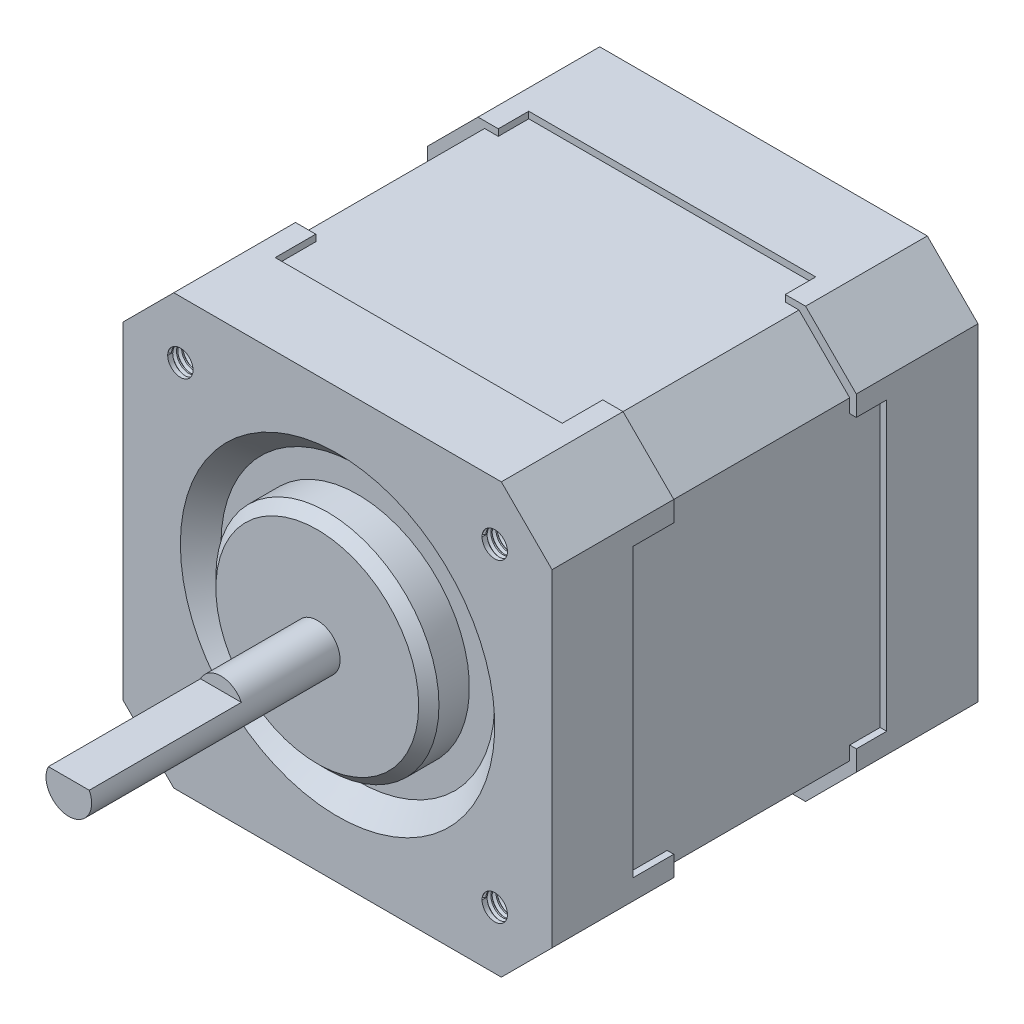
from build123d import *

# Parameters (mm, degrees)
BOSS_EXTRUDE1_DEPTH        = 12
CUT_EXTRUDE1_DEPTH         = 6
CUT_EXTRUDE2_REACH         = 50.792
SKETCH3_W                  = 4
SKETCH3_H                  = 28.3
CUT_EXTRUDE3_DEPTH         = 49.79152078
CUT_EXTRUDE3_DEPTH_BACK    = 49.79152078
SKETCH4_W                  = 28.3
SKETCH4_H                  = 4
BOSS_EXTRUDE2_DEPTH        = 36
BOSS_EXTRUDE5_DEPTH        = 6
CUT_EXTRUDE6_DEPTH         = 6
SKETCH12_W                 = 3
SKETCH12_H                 = 28.3
CUT_EXTRUDE7_DEPTH         = 64.250395256
SKETCH14_R                 = 11
BOSS_EXTRUDE6_DEPTH        = 4
CHAMFER1_SIZE              = 1
SKETCH15_R                 = 2.25
BOSS_EXTRUDE7_DEPTH        = 24.5
CUT_EXTRUDE8_START         = -15
CUT_EXTRUDE8_DEPTH         = 15
SKETCH17_W                 = 28.3
SKETCH17_H                 = 3
CUT_EXTRUDE9_DEPTH         = 64.250395256
M3_TAPPED_HOLE1_AT_2_COUNT = 2
M3_TAPPED_HOLE1_AT_2_PITCH = 31
M3_TAPPED_HOLE1_AT_3_COUNT = 2
M3_TAPPED_HOLE1_AT_3_PITCH = 31
M3_TAPPED_HOLE1_AT_4_COUNT = 2
M3_TAPPED_HOLE1_AT_4_PITCH = 43.840620434
THREAD1_PITCH              = 0.5
THREAD2_PITCH              = 0.5
THREAD3_PITCH              = 0.5
THREAD4_PITCH              = 0.5


with BuildPart() as part:
    # Sketch1 → Boss-Extrude1 (new body)
    with BuildSketch(Plane.XY):
        Polygon((-16.15, 21.15), (16.15, 21.15), (21.15, 16.15), (21.15, -16.15), (16.15, -21.15), (-16.15, -21.15), (-21.15, -16.15), (-21.15, 16.15), align=None)
    extrude(amount=-BOSS_EXTRUDE1_DEPTH)

    # Sketch2 → Cut-Extrude1 (cut)
    with BuildSketch(Plane(origin=(0, 0, -12), x_dir=(-1, 0, 0), z_dir=(0, 0, -1))):
        Polygon((-20.5, 15.5), (-15.5, 20.5), (15.5, 20.5), (20.5, 15.5), (20.5, -15.5), (15.5, -20.5), (-15.5, -20.5), (-20.5, -15.5), align=None)
    extrude(amount=-CUT_EXTRUDE1_DEPTH, mode=Mode.SUBTRACT)

    # Cut-Extrude2: up to this face of the body (flat: up to its plane)
    cut_extrude2_end = Plane(part.part.faces().sort_by_distance((-21.15, 0, -6))[0])
    # Sketch3 → Cut-Extrude2 (cut, up to the picked face)
    with BuildSketch(Plane(origin=(21.15, 0, 0), x_dir=(0, 0, -1), z_dir=(1, 0, 0)), mode=Mode.PRIVATE) as cut_extrude2_sk1:
        with Locations((10, 0)):
            Rectangle(SKETCH3_W, SKETCH3_H)
    cut_extrude2_tool1 = split(extrude(cut_extrude2_sk1.sketch, amount=-CUT_EXTRUDE2_REACH, mode=Mode.PRIVATE), bisect_by=cut_extrude2_end, keep=Keep.BOTH, mode=Mode.PRIVATE)
    add(cut_extrude2_tool1.solids().sort_by(Axis((21.15, 0, -10), (-1, 0, 0)))[0], mode=Mode.SUBTRACT)

    # Sketch4 → Cut-Extrude3 (cut, two sides: drawn at the far end of the back side and taken through both)
    with BuildSketch(Plane(origin=(0, 21.15, 0), x_dir=(1, 0, 0), z_dir=(0, 1, 0)).offset(-CUT_EXTRUDE3_DEPTH_BACK)):
        with Locations((0, 10)):
            Rectangle(SKETCH4_W, SKETCH4_H)
    extrude(amount=CUT_EXTRUDE3_DEPTH + CUT_EXTRUDE3_DEPTH_BACK, mode=Mode.SUBTRACT)

    # Sketch5 → Boss-Extrude2 (add)
    with BuildSketch(Plane(origin=(0, 0, -6), x_dir=(-1, 0, 0), z_dir=(0, 0, -1))):
        Polygon((-15.5, -20.5), (-20.5, -15.5), (-20.5, 15.5), (-15.5, 20.5), (15.5, 20.5), (20.5, 15.5), (20.5, -15.5), (15.5, -20.5), align=None)
    extrude(amount=BOSS_EXTRUDE2_DEPTH)

    # Sketch13 → Cut-Revolve1 (revolve, cut)
    with BuildSketch(Plane(origin=(0, 0, 0), x_dir=(0, 0, -1), z_dir=(1, 0, 0)), mode=Mode.PRIVATE) as cut_revolve1_sk:
        Polygon((0, 0), (0, 15.5), (2, 13.5), (2, 0), align=None)
    revolve(cut_revolve1_sk.sketch.rotate(Axis((0, 0, -2), (0, 0, 1)), 90), axis=Axis((0, 0, -2), (0, 0, 1)), mode=Mode.SUBTRACT)

    # Sketch14 → Boss-Extrude6 (add)
    with BuildSketch(Plane.XY.offset(-2)):
        with Locations(Location((0, 0, 0), (0, 0, 180))):
            Circle(SKETCH14_R)
    extrude(amount=BOSS_EXTRUDE6_DEPTH)

    # Chamfer1
    chamfer1_edges = [part.edges().sort_by_distance(p)[0] for p in [
        (11, 0, 2),
    ]]
    chamfer(chamfer1_edges, length=CHAMFER1_SIZE)

    # Sketch15 → Boss-Extrude7 (add)
    with BuildSketch(Plane.XY.offset(2)):
        Circle(SKETCH15_R)
    extrude(amount=BOSS_EXTRUDE7_DEPTH)

    # Sketch16 → Cut-Extrude8 (cut)
    with BuildSketch(Plane.XY.offset(26.5).offset(CUT_EXTRUDE8_START)):
        with BuildLine():
            Line((-2.015564437, 1), (2.015564437, 1))
            ThreePointArc((2.015564437, 1), (0, 2.25), (-2.015564437, 1))
        make_face()
    extrude(amount=CUT_EXTRUDE8_DEPTH, mode=Mode.SUBTRACT)

    # Sketch20 → M3 Tapped Hole1 (revolve, cut)
    with BuildSketch(Plane(origin=(-15.5, 15.5, 0), x_dir=(0, -1, 0), z_dir=(1, 0, 0))):
        Polygon((0, 0), (0, 5.251075774), (1.25, 4.5), (1.25, 0), align=None)
    m3_tapped_hole1 = revolve(axis=Axis((-15.5, 15.5, 6.35), (0, 0, -1)), mode=Mode.SUBTRACT)

    # M3 Tapped Hole1 at 2: M3 Tapped Hole1 ×2
    with Locations(*[(i * M3_TAPPED_HOLE1_AT_2_PITCH, 0, 0) for i in range(1, M3_TAPPED_HOLE1_AT_2_COUNT)]):
        add(m3_tapped_hole1, mode=Mode.SUBTRACT)

    # M3 Tapped Hole1 at 3: M3 Tapped Hole1 ×2
    with Locations(*[(0, -i * M3_TAPPED_HOLE1_AT_3_PITCH, 0) for i in range(1, M3_TAPPED_HOLE1_AT_3_COUNT)]):
        add(m3_tapped_hole1, mode=Mode.SUBTRACT)

    # M3 Tapped Hole1 at 4: M3 Tapped Hole1 ×2
    with Locations(*[Vector(0.7071067811865476, -0.7071067811865476, 0) * (i * M3_TAPPED_HOLE1_AT_4_PITCH) for i in range(1, M3_TAPPED_HOLE1_AT_4_COUNT)]):
        add(m3_tapped_hole1, mode=Mode.SUBTRACT)

    # Thread1: the profile of Thread Profile1 profile screwed along a right-hand helix of 9 turns, 6 arcs to a turn; built about Z, then put on its axis
    thread1_z = Axis((0, 0, 0), (0, 0, 1))
    thread1_corners = [(1.2497, 0, -0.000173205), (1.520632937, 0, 0.156249999), (1.520632937, 0, 0.218749999), (1.2497, 0, 0.375173204)]
    with BuildLine(mode=Mode.PRIVATE) as thread1_profile:
        Line(thread1_corners[0], thread1_corners[1])
        Line(thread1_corners[1], thread1_corners[2])
        Line(thread1_corners[2], thread1_corners[3])
        Line(thread1_corners[3], thread1_corners[0])
    thread1_cap = Face(thread1_profile.wire())
    thread1_turn_angles = [0, 30, 60, 90, 120, 150, 180, 210, 240, 270, 300, 330, 360]
    thread1_turn_weights = [1, 0.8660254037844387, 1, 0.8660254037844387, 1, 0.8660254037844387, 1, 0.8660254037844387, 1, 0.8660254037844387, 1, 0.8660254037844387, 1]
    thread1_turn_rails = [Edge.make_bspline([Vector(p[0], p[1], 0).rotate(thread1_z, thread1_turn_angles[k]) / thread1_turn_weights[k] + Vector(0, 0, p[2] + THREAD1_PITCH * thread1_turn_angles[k] / 360) for k in range(13)], [0, 0, 0, 1, 1, 2, 2, 3, 3, 4, 4, 5, 5, 6, 6, 6], 2, thread1_turn_weights) for p in thread1_corners]
    thread1_turn_sides = [Face.make_surface_from_curves(thread1_turn_rails[p[0]], thread1_turn_rails[p[1]]) for p in [(0, 1), (1, 2), (2, 3), (3, 0)]]
    thread1 = Plane(origin=(-15.5, 15.5, 0), x_dir=(-1, 0, 0), z_dir=(0, 0, -1)) * Solid(Shell([*[p.moved(Location((0, 0, THREAD1_PITCH * i))) for i in range(9) for p in thread1_turn_sides], thread1_cap, thread1_cap.rotate(thread1_z, 3240).moved(Location((0, 0, THREAD1_PITCH * 3240 / 360)))]))
    add(thread1, mode=Mode.SUBTRACT)

    # Thread2: the profile of Thread Profile2 profile screwed along a right-hand helix of 9 turns, 6 arcs to a turn; built about Z, then put on its axis
    thread2_z = Axis((0, 0, 0), (0, 0, 1))
    thread2_corners = [(1.2497, 0, -0.000173205), (1.520632937, 0, 0.156249999), (1.520632937, 0, 0.218749999), (1.2497, 0, 0.375173204)]
    with BuildLine(mode=Mode.PRIVATE) as thread2_profile:
        Line(thread2_corners[0], thread2_corners[1])
        Line(thread2_corners[1], thread2_corners[2])
        Line(thread2_corners[2], thread2_corners[3])
        Line(thread2_corners[3], thread2_corners[0])
    thread2_cap = Face(thread2_profile.wire())
    thread2_turn_angles = [0, 30, 60, 90, 120, 150, 180, 210, 240, 270, 300, 330, 360]
    thread2_turn_weights = [1, 0.8660254037844387, 1, 0.8660254037844387, 1, 0.8660254037844387, 1, 0.8660254037844387, 1, 0.8660254037844387, 1, 0.8660254037844387, 1]
    thread2_turn_rails = [Edge.make_bspline([Vector(p[0], p[1], 0).rotate(thread2_z, thread2_turn_angles[k]) / thread2_turn_weights[k] + Vector(0, 0, p[2] + THREAD2_PITCH * thread2_turn_angles[k] / 360) for k in range(13)], [0, 0, 0, 1, 1, 2, 2, 3, 3, 4, 4, 5, 5, 6, 6, 6], 2, thread2_turn_weights) for p in thread2_corners]
    thread2_turn_sides = [Face.make_surface_from_curves(thread2_turn_rails[p[0]], thread2_turn_rails[p[1]]) for p in [(0, 1), (1, 2), (2, 3), (3, 0)]]
    thread2 = Plane(origin=(15.5, 15.5, 0), x_dir=(-1, 0, 0), z_dir=(0, 0, -1)) * Solid(Shell([*[p.moved(Location((0, 0, THREAD2_PITCH * i))) for i in range(9) for p in thread2_turn_sides], thread2_cap, thread2_cap.rotate(thread2_z, 3240).moved(Location((0, 0, THREAD2_PITCH * 3240 / 360)))]))
    add(thread2, mode=Mode.SUBTRACT)

    # Thread3: the profile of Thread Profile3 profile screwed along a right-hand helix of 9 turns, 6 arcs to a turn; built about Z, then put on its axis
    thread3_z = Axis((0, 0, 0), (0, 0, 1))
    thread3_corners = [(1.2497, 0, -0.000173205), (1.520632937, 0, 0.156249999), (1.520632937, 0, 0.218749999), (1.2497, 0, 0.375173204)]
    with BuildLine(mode=Mode.PRIVATE) as thread3_profile:
        Line(thread3_corners[0], thread3_corners[1])
        Line(thread3_corners[1], thread3_corners[2])
        Line(thread3_corners[2], thread3_corners[3])
        Line(thread3_corners[3], thread3_corners[0])
    thread3_cap = Face(thread3_profile.wire())
    thread3_turn_angles = [0, 30, 60, 90, 120, 150, 180, 210, 240, 270, 300, 330, 360]
    thread3_turn_weights = [1, 0.8660254037844387, 1, 0.8660254037844387, 1, 0.8660254037844387, 1, 0.8660254037844387, 1, 0.8660254037844387, 1, 0.8660254037844387, 1]
    thread3_turn_rails = [Edge.make_bspline([Vector(p[0], p[1], 0).rotate(thread3_z, thread3_turn_angles[k]) / thread3_turn_weights[k] + Vector(0, 0, p[2] + THREAD3_PITCH * thread3_turn_angles[k] / 360) for k in range(13)], [0, 0, 0, 1, 1, 2, 2, 3, 3, 4, 4, 5, 5, 6, 6, 6], 2, thread3_turn_weights) for p in thread3_corners]
    thread3_turn_sides = [Face.make_surface_from_curves(thread3_turn_rails[p[0]], thread3_turn_rails[p[1]]) for p in [(0, 1), (1, 2), (2, 3), (3, 0)]]
    thread3 = Plane(origin=(-15.5, -15.5, 0), x_dir=(-1, 0, 0), z_dir=(0, 0, -1)) * Solid(Shell([*[p.moved(Location((0, 0, THREAD3_PITCH * i))) for i in range(9) for p in thread3_turn_sides], thread3_cap, thread3_cap.rotate(thread3_z, 3240).moved(Location((0, 0, THREAD3_PITCH * 3240 / 360)))]))
    add(thread3, mode=Mode.SUBTRACT)

    # Thread4: the profile of Thread Profile4 profile screwed along a right-hand helix of 9 turns, 6 arcs to a turn; built about Z, then put on its axis
    thread4_z = Axis((0, 0, 0), (0, 0, 1))
    thread4_corners = [(1.2497, 0, -0.000173205), (1.520632937, 0, 0.156249999), (1.520632937, 0, 0.218749999), (1.2497, 0, 0.375173204)]
    with BuildLine(mode=Mode.PRIVATE) as thread4_profile:
        Line(thread4_corners[0], thread4_corners[1])
        Line(thread4_corners[1], thread4_corners[2])
        Line(thread4_corners[2], thread4_corners[3])
        Line(thread4_corners[3], thread4_corners[0])
    thread4_cap = Face(thread4_profile.wire())
    thread4_turn_angles = [0, 30, 60, 90, 120, 150, 180, 210, 240, 270, 300, 330, 360]
    thread4_turn_weights = [1, 0.8660254037844387, 1, 0.8660254037844387, 1, 0.8660254037844387, 1, 0.8660254037844387, 1, 0.8660254037844387, 1, 0.8660254037844387, 1]
    thread4_turn_rails = [Edge.make_bspline([Vector(p[0], p[1], 0).rotate(thread4_z, thread4_turn_angles[k]) / thread4_turn_weights[k] + Vector(0, 0, p[2] + THREAD4_PITCH * thread4_turn_angles[k] / 360) for k in range(13)], [0, 0, 0, 1, 1, 2, 2, 3, 3, 4, 4, 5, 5, 6, 6, 6], 2, thread4_turn_weights) for p in thread4_corners]
    thread4_turn_sides = [Face.make_surface_from_curves(thread4_turn_rails[p[0]], thread4_turn_rails[p[1]]) for p in [(0, 1), (1, 2), (2, 3), (3, 0)]]
    thread4 = Plane(origin=(15.5, -15.5, 0), x_dir=(-1, 0, 0), z_dir=(0, 0, -1)) * Solid(Shell([*[p.moved(Location((0, 0, THREAD4_PITCH * i))) for i in range(9) for p in thread4_turn_sides], thread4_cap, thread4_cap.rotate(thread4_z, 3240).moved(Location((0, 0, THREAD4_PITCH * 3240 / 360)))]))
    add(thread4, mode=Mode.SUBTRACT)


with BuildPart() as body_2:
    # Sketch10 → Boss-Extrude5 (new, symmetric)
    with BuildSketch(Plane.XY.offset(-36)):
        Polygon((21.15, 16.15), (16.15, 21.15), (-16.15, 21.15), (-21.15, 16.15), (-21.15, -16.15), (-16.15, -21.15), (16.15, -21.15), (21.15, -16.15), align=None)
    extrude(amount=BOSS_EXTRUDE5_DEPTH, both=True)

    # Sketch11 → Cut-Extrude6 (cut)
    with BuildSketch(Plane.XY.offset(-30)):
        Polygon((-20.5, 15.5), (-15.5, 20.5), (15.5, 20.5), (20.5, 15.5), (20.5, -15.5), (15.5, -20.5), (-15.5, -20.5), (-20.5, -15.5), align=None)
    extrude(amount=-CUT_EXTRUDE6_DEPTH, mode=Mode.SUBTRACT)

    # Sketch12 → Cut-Extrude7 (cut, through all)
    with BuildSketch(Plane(origin=(21.15, 0, 0), x_dir=(0, 0, -1), z_dir=(1, 0, 0))):
        with Locations((31.5, 0)):
            Rectangle(SKETCH12_W, SKETCH12_H)
    extrude(amount=-CUT_EXTRUDE7_DEPTH, mode=Mode.SUBTRACT)

    # Sketch17 → Cut-Extrude9 (cut, through all)
    with BuildSketch(Plane(origin=(0, 21.15, 0), x_dir=(1, 0, 0), z_dir=(0, 1, 0))):
        with Locations((0, 31.5)):
            Rectangle(SKETCH17_W, SKETCH17_H)
    extrude(amount=-CUT_EXTRUDE9_DEPTH, mode=Mode.SUBTRACT)


solid = Compound([part.part, body_2.part])
